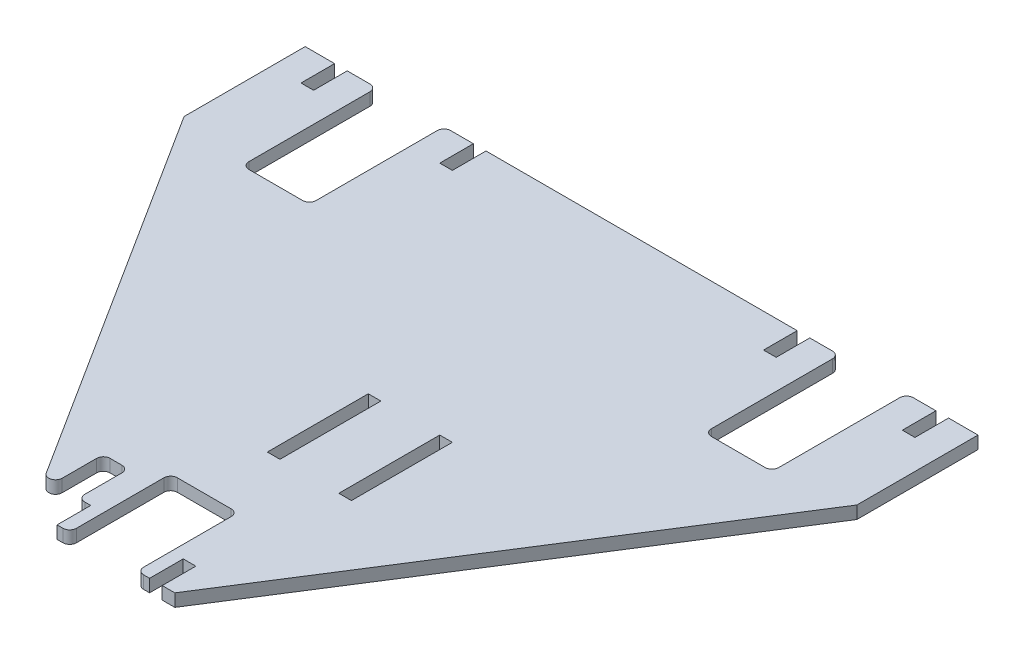
from build123d import *

# Parameters (mm, degrees)
BOSS_EXTRUDE1_DEPTH = 4.7625
SKETCH2_W           = 4.7625
SKETCH2_H           = 38.1
SKETCH2_W_2         = 9.525
SKETCH2_H_2         = 31.75
CUT_EXTRUDE1_DEPTH  = 163.709069834
FILLET1_R           = 2.54
FILLET2_R           = 2.54


with BuildPart() as part:
    # Sketch1 → Boss-Extrude1 (new body)
    with BuildSketch(Plane(origin=(0, 0, 0), x_dir=(1, 0, 0), z_dir=(0, 1, 0))):
        Polygon((12.7, -63.5), (-12.7, -63.5), (-12.7, -101.6), (-17.4625, -101.6), (-17.4625, -88.9), (-22.225, -88.9), (-22.225, -101.6), (-26.9875, -101.6), (-127, 55.88), (-127, 101.6), (-115.8875, 101.6), (-115.8875, 88.9), (-111.125, 88.9), (-111.125, 101.6), (-100.0125, 101.6), (-100.0125, 50.8), (-74.6125, 50.8), (-74.6125, 101.6), (-63.5, 101.6), (-63.5, 88.9), (-58.7375, 88.9), (-58.7375, 101.6), (58.7375, 101.6), (58.7375, 88.9), (63.5, 88.9), (63.5, 101.6), (74.6125, 101.6), (74.6125, 50.8), (100.0125, 50.8), (100.0125, 101.6), (111.125, 101.6), (111.125, 88.9), (115.8875, 88.9), (115.8875, 101.6), (127, 101.6), (127, 55.88), (26.9875, -101.6), (22.225, -101.6), (22.225, -88.9), (17.4625, -88.9), (17.4625, -101.6), (12.7, -101.6), align=None)
    extrude(amount=BOSS_EXTRUDE1_DEPTH)

    # Sketch2 → Cut-Extrude1 (cut, through all)
    with BuildSketch(Plane(origin=(0, 4.7625, 0), x_dir=(1, 0, 0), z_dir=(0, 1, 0))):
        with Locations((0.79375, -19.05)):
            Rectangle(SKETCH2_W, SKETCH2_H)
        with Locations((-26.9875, -85.725)):
            Rectangle(SKETCH2_W_2, SKETCH2_H_2)
        with Locations((27.78125, -19.05)):
            Rectangle(SKETCH2_W, SKETCH2_H)
    extrude(amount=-CUT_EXTRUDE1_DEPTH, mode=Mode.SUBTRACT)

    # Fillet1
    fillet1_edges = [part.edges().sort_by_distance(p)[0] for p in [
        (-22.225, 2.38125, 88.9),
        (-31.75, 2.38125, 94.100952381),
        (-22.225, 2.38125, 69.85),
        (-31.75, 2.38125, 69.85),
    ]]
    fillet(fillet1_edges, radius=FILLET1_R)

    # Fillet2
    fillet2_edges = [part.edges().sort_by_distance(p)[0] for p in [
        (-12.7, 2.38125, 101.6),
        (12.7, 2.38125, 101.6),
        (12.7, 2.38125, 63.5),
        (-12.7, 2.38125, 63.5),
        (100.0125, 2.38125, -101.6),
        (100.0125, 2.38125, -50.8),
        (74.6125, 2.38125, -101.6),
        (74.6125, 2.38125, -50.8),
        (-100.0125, 2.38125, -101.6),
        (-74.6125, 2.38125, -101.6),
        (-74.6125, 2.38125, -50.8),
        (-100.0125, 2.38125, -50.8),
    ]]
    fillet(fillet2_edges, radius=FILLET2_R)


solid = part.part
